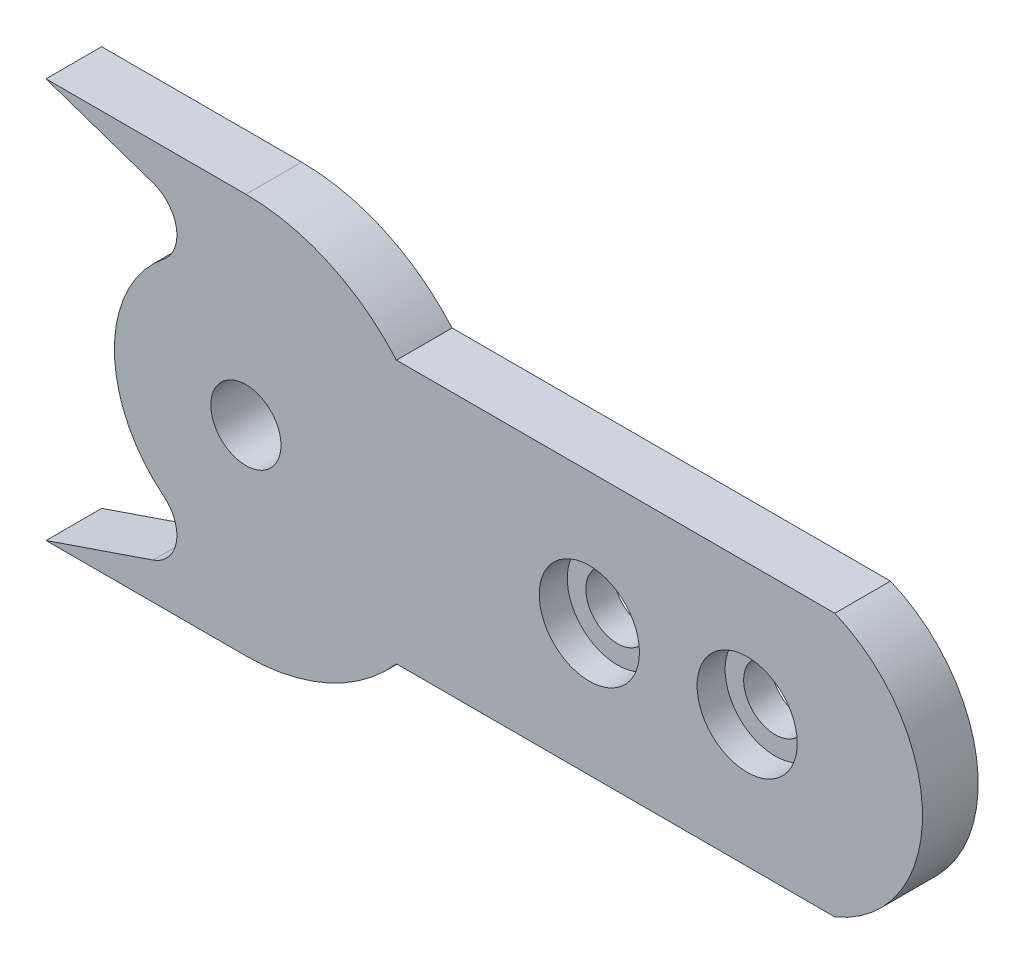
from build123d import *

# Parameters (mm, degrees)
SKETCH1_R           = 10
BOSS_EXTRUDE1_DEPTH = 7.9375
FILLET1_R           = 10
SKETCH2_R           = 14.2875
CUT_EXTRUDE1_DEPTH  = 8
SKETCH3_R           = 9
CUT_EXTRUDE2_DEPTH  = 202.796790966


with BuildPart() as part:
    # Sketch1 → Boss-Extrude1 (new, symmetric)
    with BuildSketch(Plane.XY):
        with BuildLine():
            Line((-57, -57), (0, -37.5))
            ThreePointArc((0, -37.5), (-37.5, 0), (0, 37.5))
            Line((0, 37.5), (-57, 57))
            Line((-57, 57), (0, 57))
            ThreePointArc((0, 57), (23.574350468, 51.896531676), (42.927264064, 37.5))
            Line((42.927264064, 37.5), (167.927264064, 37.5))
            ThreePointArc((167.927264064, 37.5), (192.927264064, 0), (167.927264064, -37.5))
            Line((167.927264064, -37.5), (42.927264064, -37.5))
            ThreePointArc((42.927264064, -37.5), (23.574350468, -51.896531676), (0, -57))
            Line((0, -57), (-57, -57))
        make_face()
        Circle(SKETCH1_R, mode=Mode.SUBTRACT)
    extrude(amount=BOSS_EXTRUDE1_DEPTH, both=True)

    # Fillet1
    fillet1_edges = [part.edges().sort_by_distance(p)[0] for p in [
        (0, -37.5, 0),
        (0, 37.5, 0),
    ]]
    fillet(fillet1_edges, radius=FILLET1_R)

    # Sketch2 → Cut-Extrude1 (cut)
    with BuildSketch(Plane.XY.offset(7.9375)):
        with Locations((142.927264064, 0)):
            Circle(SKETCH2_R)
        with Locations((97.927264064, 0)):
            Circle(SKETCH2_R)
    extrude(amount=-CUT_EXTRUDE1_DEPTH, mode=Mode.SUBTRACT)

    # Sketch3 → Cut-Extrude2 (cut, through all)
    with BuildSketch(Plane.XY.offset(7.9375)):
        with Locations((97.927264064, 0)):
            Circle(SKETCH3_R)
        with Locations((142.927264064, 0)):
            Circle(SKETCH3_R)
    extrude(amount=-CUT_EXTRUDE2_DEPTH, mode=Mode.SUBTRACT)


solid = part.part
